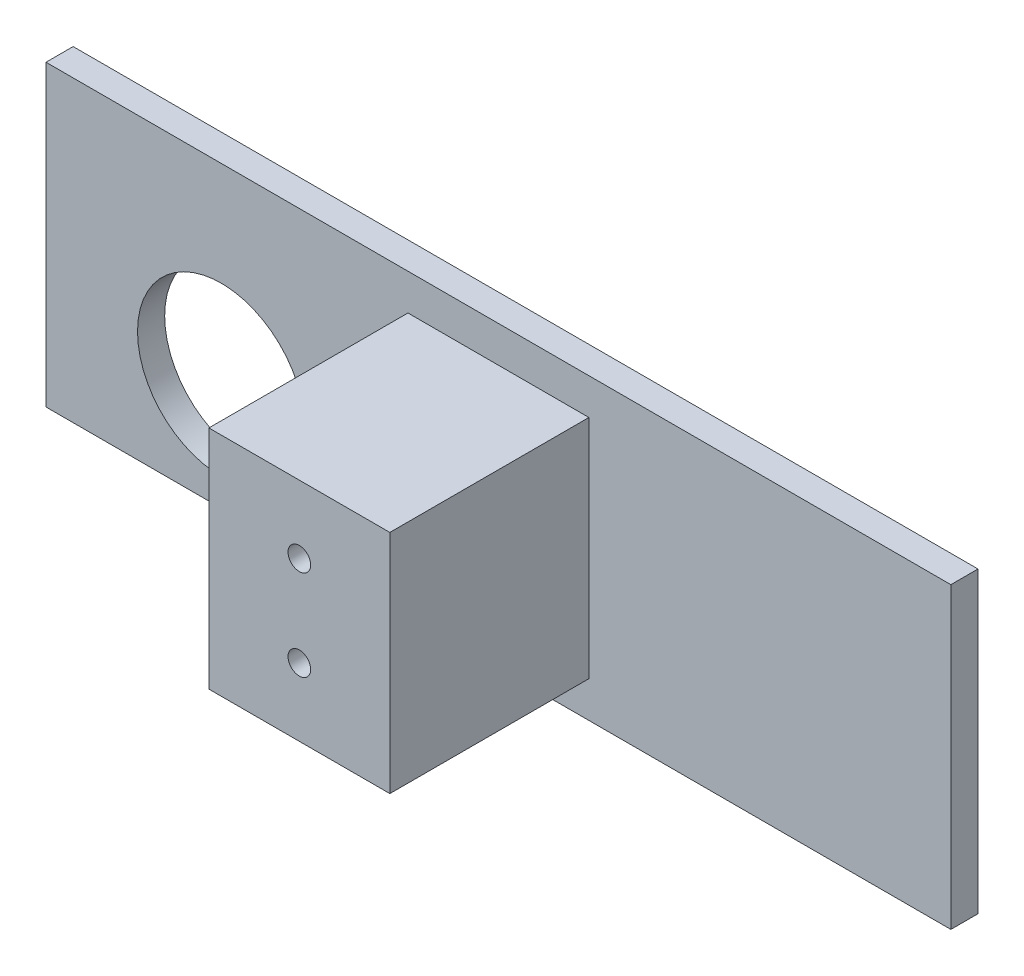
from build123d import *

# Parameters (mm, degrees)
ESQUISSE1_W             = 20
ESQUISSE1_H             = 25
BOSS_EXTRU_1_DEPTH      = 22
ESQUISSE2_R             = 1.25
ENL_V_MAT_EXTRU_1_DEPTH = 15
ESQUISSE3_W             = 100
ESQUISSE3_H             = 33
BOSS_EXTRU_2_DEPTH      = 3
ENL_V_MAT_EXTRU_2_REACH = 62.426
ESQUISSE4_R             = 9.25


with BuildPart() as part:
    # Esquisse1 → Boss.-Extru.1 (new body)
    with BuildSketch(Plane.XY):
        with Locations((-2.234848485, 0.757575758)):
            Rectangle(ESQUISSE1_W, ESQUISSE1_H)
    extrude(amount=BOSS_EXTRU_1_DEPTH)

    # Esquisse2 → Enlèv. mat.-Extru.1 (cut)
    with BuildSketch(Plane.XY.offset(22)):
        with Locations((-2.234848485, 5.757575758)):
            Circle(ESQUISSE2_R)
        with Locations((-2.234848485, -4.242424242)):
            Circle(ESQUISSE2_R)
    extrude(amount=-ENL_V_MAT_EXTRU_1_DEPTH, mode=Mode.SUBTRACT)

    # Esquisse3 → Boss.-Extru.2 (add)
    with BuildSketch(Plane(origin=(0, 0, 0), x_dir=(-1, 0, 0), z_dir=(0, 0, -1))):
        with Locations((2.234848485, 0.757575758)):
            Rectangle(ESQUISSE3_W, ESQUISSE3_H)
    extrude(amount=BOSS_EXTRU_2_DEPTH)

    # Esquisse4 → Enlèv. mat.-Extru.2 (cut, up to next)
    with BuildSketch(Plane(origin=(0, 0, -3), x_dir=(-1, 0, 0), z_dir=(0, 0, -1)), mode=Mode.PRIVATE) as enl_v_mat_extru_2_sk1:
        with Locations((32.869848485, -3.452132942)):
            Circle(ESQUISSE4_R)
    enl_v_mat_extru_2_tool1 = extrude(enl_v_mat_extru_2_sk1.sketch, amount=-ENL_V_MAT_EXTRU_2_REACH, mode=Mode.PRIVATE) & part.part
    add(enl_v_mat_extru_2_tool1.solids().sort_by_distance((-32.869848, -3.452133, -3))[0], mode=Mode.SUBTRACT)


solid = part.part
